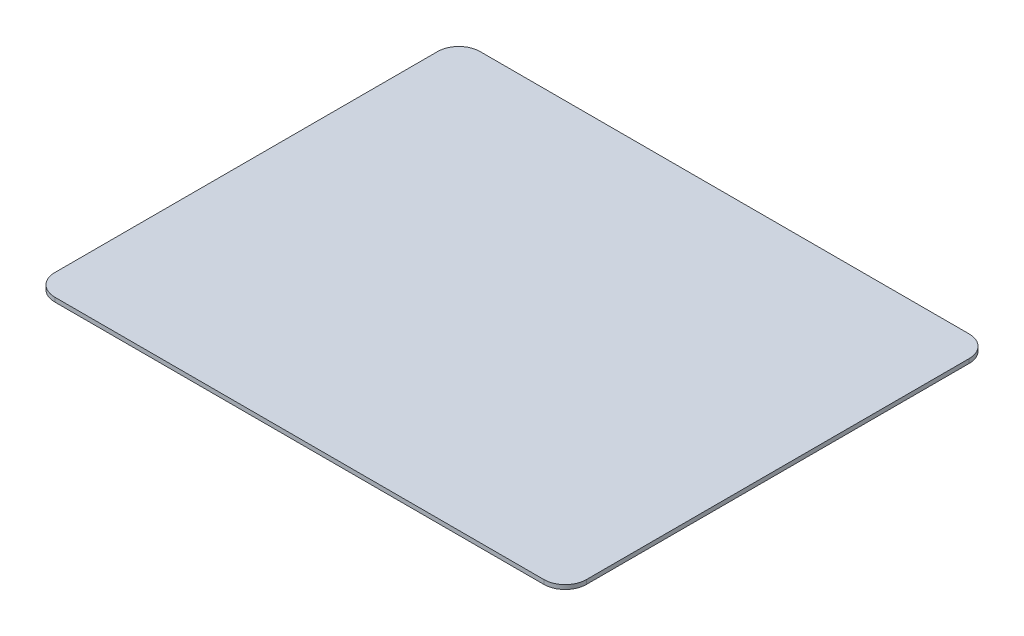
from build123d import *

# Parameters (mm, degrees)
FLANGE_BASE1_DEPTH = 2


# Sheet-metal steps are written as plain solids
with BuildPart() as part:
    # Esboço1 → Flange-base1 (new body)
    with BuildSketch(Plane(origin=(0, 0, 0), x_dir=(1, 0, 0), z_dir=(0, 1, 0))):
        with BuildLine():
            Line((-115, -100), (115, -100))
            ThreePointArc((115, -100), (122.071067812, -97.071067812), (125, -90))
            Line((125, -90), (125, 90))
            ThreePointArc((125, 90), (122.071067812, 97.071067812), (115, 100))
            Line((115, 100), (-115, 100))
            ThreePointArc((-115, 100), (-122.071067812, 97.071067812), (-125, 90))
            Line((-125, 90), (-125, -90))
            ThreePointArc((-125, -90), (-122.071067812, -97.071067812), (-115, -100))
        make_face()
    extrude(amount=-FLANGE_BASE1_DEPTH)


solid = part.part
